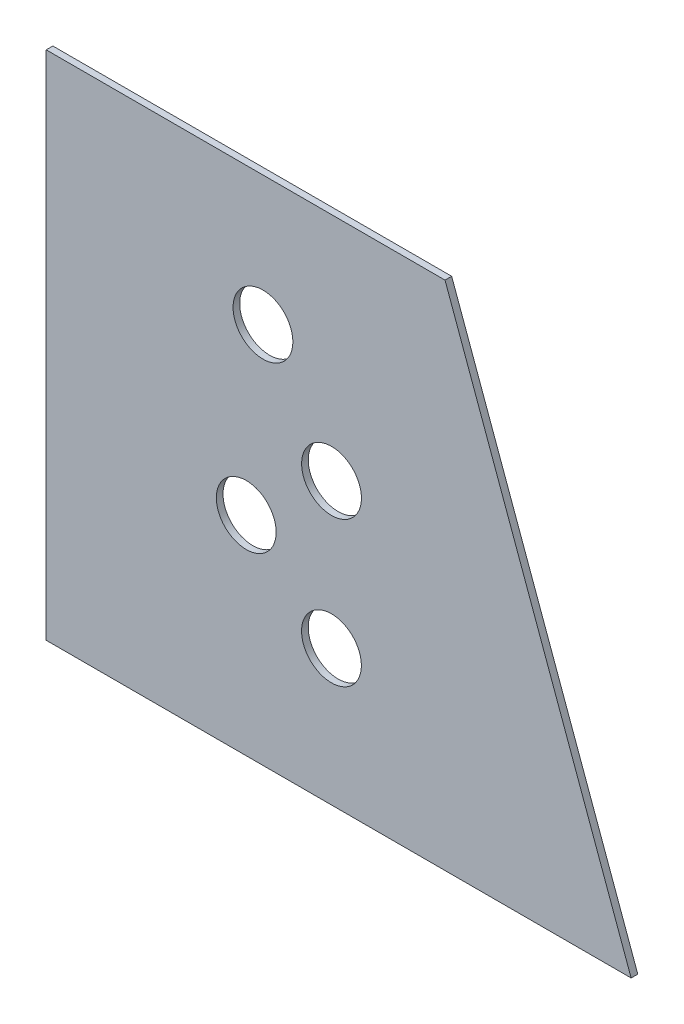
from build123d import *

# Parameters (mm, degrees)
SKETCH1_R           = 14.2875
BOSS_EXTRUDE1_DEPTH = 3.175


with BuildPart() as part:
    # Sketch1 → Boss-Extrude1 (new body)
    with BuildSketch(Plane.XY):
        Polygon((-0.143913003, 244.25074259), (190.356086997, 244.25074259), (279.256086997, 0), (-0.143913003, 0), align=None)
        with Locations((103.388340026, 182.370587185)):
            Circle(SKETCH1_R, mode=Mode.SUBTRACT)
        with Locations((136.137199433, 134.070794552)):
            Circle(SKETCH1_R, mode=Mode.SUBTRACT)
        with Locations((95.404181186, 99.600107565)):
            Circle(SKETCH1_R, mode=Mode.SUBTRACT)
        with Locations((136.109778525, 64.806808111)):
            Circle(SKETCH1_R, mode=Mode.SUBTRACT)
    extrude(amount=BOSS_EXTRUDE1_DEPTH)


solid = part.part
